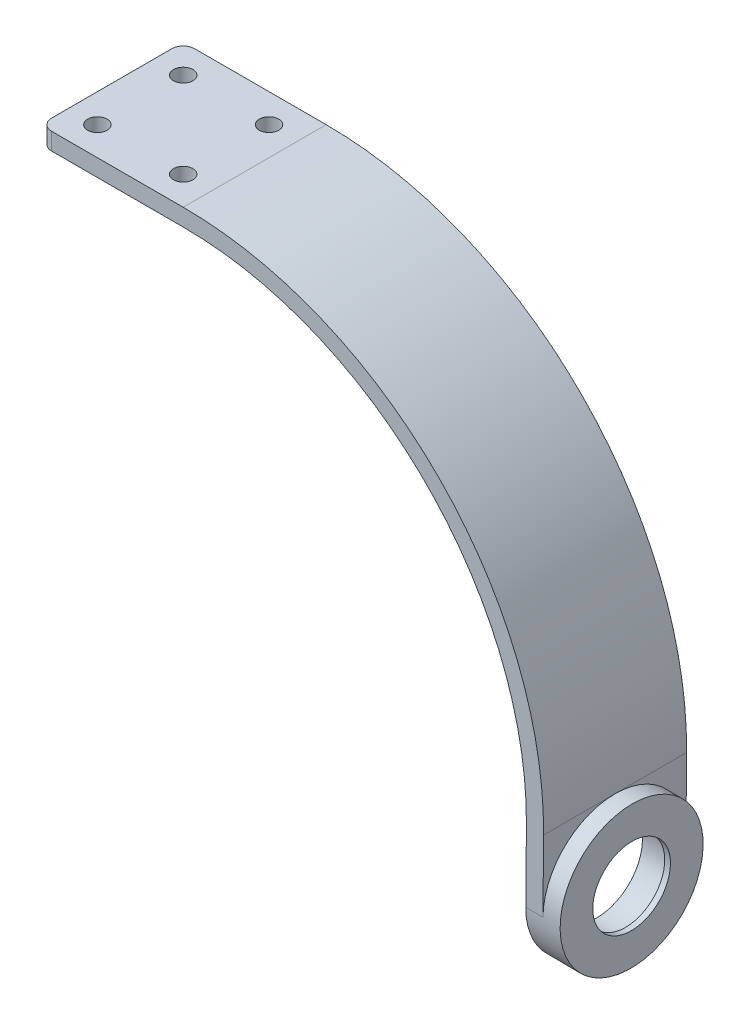
from build123d import *

# Parameters (mm, degrees)
BOSS_EXTRUDE1_DEPTH  = 25
M3_CLEARANCE_HOLE1_D = 3.4
SKETCH6_R            = 7.89
CUT_EXTRUDE1_DEPTH   = 3
FILLET1_R            = 12.5
FILLET2_R            = 2
SKETCH7_R            = 12.5
SKETCH7_R_2          = 6.79
BOSS_EXTRUDE2_DEPTH  = 3
CUT_EXTRUDE2_START   = -5
SKETCH9_R            = 7.89
CUT_EXTRUDE2_DEPTH   = 5


with BuildPart() as part:
    # Sketch2 → Boss-Extrude1 (new body)
    with BuildSketch(Plane.XY):
        with BuildLine():
            Line((0, 63), (-25, 63))
            Line((-25, 63), (-25, 60))
            Line((-25, 60), (0, 60))
            ThreePointArc((0, 60), (42.611122537, 42.240883467), (59.997715384, -0.52359213))
            Line((59.997715384, -0.52359213), (59.779551996, -25.522640207))
            Line((59.779551996, -25.522640207), (62.779437766, -25.548819813))
            Line((62.779437766, -25.548819813), (62.997601153, -0.549771736))
            ThreePointArc((62.997601153, -0.549771736), (44.741678664, 44.352927641), (0, 63))
        make_face()
    extrude(amount=BOSS_EXTRUDE1_DEPTH)

    # M3 Clearance Hole1 (through all)
    with Locations(Plane(origin=(0, 63, 0), x_dir=(1, 0, 0), z_dir=(0, 1, 0))):
        with Locations((-20, -5), (-5, -20), (-20, -20), (-5, -5)):
            Hole(M3_CLEARANCE_HOLE1_D / 2)

    # Sketch6 → Cut-Extrude1 (cut)
    with BuildSketch(Plane(origin=(62.997601153, -0.549771736, 0), x_dir=(0, 0, -1), z_dir=(0.9999619230641714, -0.00872653549837746, 0))):
        with Locations(Location((-12.5, -12.5, 0), (0, 0, 90))):
            Circle(SKETCH6_R)
    extrude(amount=-CUT_EXTRUDE1_DEPTH, mode=Mode.SUBTRACT)

    # Fillet1
    fillet1_edges = [part.edges().sort_by_distance(p)[0] for p in [
        (61.279494881, -25.53573001, 0),
        (61.279494881, -25.53573001, 25),
    ]]
    fillet(fillet1_edges, radius=FILLET1_R - 0.0001)  # a hair under: the kernel refuses the full size

    # Fillet2
    fillet2_edges = [part.edges().sort_by_distance(p)[0] for p in [
        (-25, 61.5, 25),
        (-25, 61.5, 0),
    ]]
    fillet(fillet2_edges, radius=FILLET2_R)

    # Sketch7 → Boss-Extrude2 (add)
    with BuildSketch(Plane(origin=(62.997601153, -0.549771736, 0), x_dir=(0, 0, -1), z_dir=(0.9999619230641714, -0.00872653549837732, 0))):
        with Locations(Location((-12.5, -12.5, 0), (0, 0, 90))):
            Circle(SKETCH7_R)
        with Locations(Location((-12.5, -12.5, 0), (0, 0, 90))):
            Circle(SKETCH7_R_2, mode=Mode.SUBTRACT)
    extrude(amount=BOSS_EXTRUDE2_DEPTH)

    # Sketch9 → Cut-Extrude2 (cut)
    with BuildSketch(Plane(origin=(59.997715384, -0.52359213, 0), x_dir=(0, 0, 1), z_dir=(-0.9999619230641714, 0.008726535498377324, 0)).offset(CUT_EXTRUDE2_START)):
        with Locations(Location((12.5, -12.5, 0), (0, 0, 90))):
            Circle(SKETCH9_R)
    extrude(amount=CUT_EXTRUDE2_DEPTH, mode=Mode.SUBTRACT)


solid = part.part
